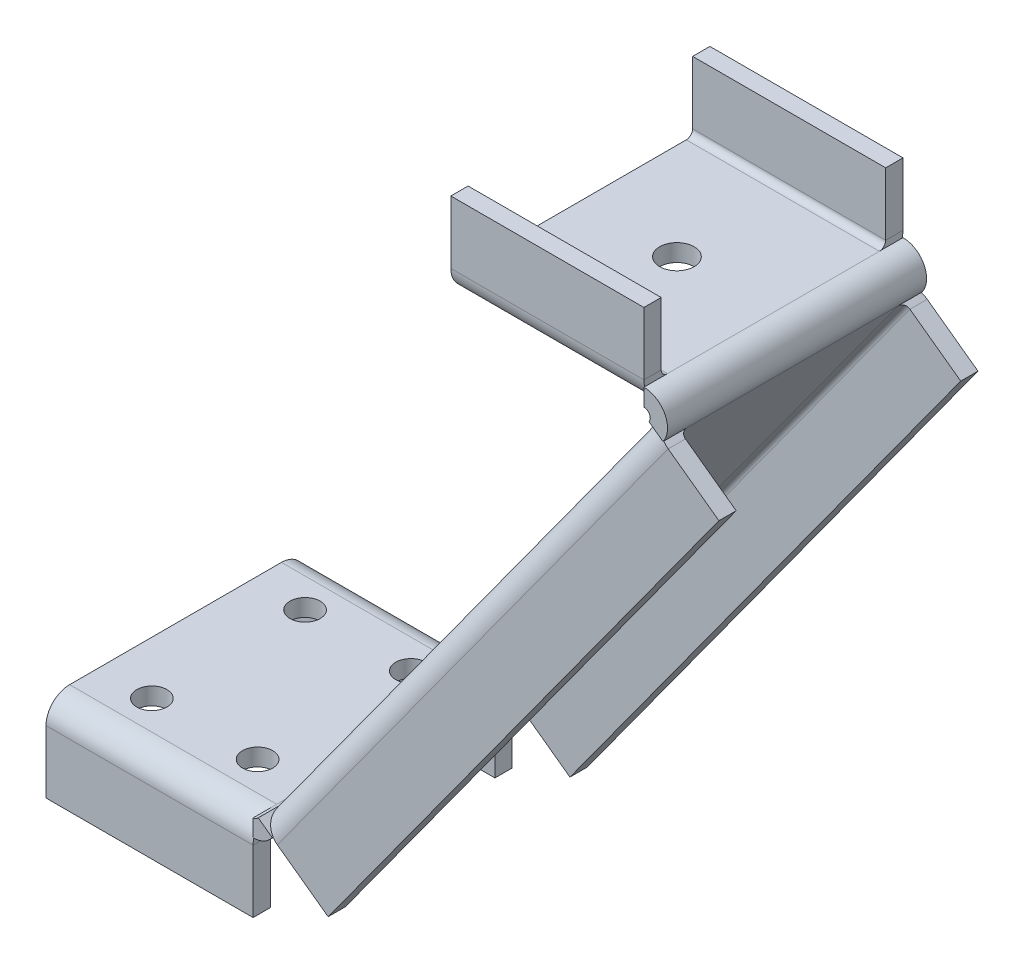
from build123d import *

# Parameters (mm, degrees)
BASE_FLANGE1_DEPTH             = 30
EDGE_FLANGE3_STRIP_W           = 9.4732
EDGE_FLANGE3_STRIP_H           = 2
EDGE_FLANGE3_STRIP_CUT_DEPTH   = 23.982438423
EDGE_FLANGE3_STRIP_2_W         = 9.4732
EDGE_FLANGE3_STRIP_2_H         = 2
EDGE_FLANGE3_STRIP_CUT_2_DEPTH = 23.982438423
EDGE_FLANGE3_STRIP_3_W         = 9.4732
EDGE_FLANGE3_STRIP_3_H         = 2
EDGE_FLANGE3_STRIP_CUT_3_DEPTH = 22.356175112
EDGE_FLANGE3_STRIP_4_W         = 9.4732
EDGE_FLANGE3_STRIP_4_H         = 2
EDGE_FLANGE3_STRIP_CUT_4_DEPTH = 22.356175112
EDGE_FLANGE3_STRIP_5_W         = 9.4732
EDGE_FLANGE3_STRIP_5_H         = 2
EDGE_FLANGE3_STRIP_CUT_5_DEPTH = 77.034991311
EDGE_FLANGE3_STRIP_6_W         = 9.4732
EDGE_FLANGE3_STRIP_6_H         = 2
EDGE_FLANGE3_STRIP_CUT_6_DEPTH = 77.034991311
EDGE_FLANGE3_DEPTH             = 23.982438423
EDGE_FLANGE3_BEND_DEPTH        = 23.982438423
EDGE_FLANGE3_BEND_2_DEPTH      = 22.356175112
EDGE_FLANGE3_BEND_3_DEPTH      = 22.356175112
EDGE_FLANGE3_BEND_4_DEPTH      = 77.034991311
EDGE_FLANGE3_BEND_5_DEPTH      = 77.034991311
CUT_EXTRUDE1_REACH             = 114.784
SKETCH35_R                     = 1.75
SKETCH35_R_2                   = 2


# Sheet-metal steps are written as plain solids
with BuildPart() as part:
    # Sketch1 → Base-Flange1 (new body)
    with BuildSketch(Plane.XY):
        with BuildLine():
            Line((0, 0), (23.982438423, 0))
            ThreePointArc((23.982438423, 0), (24.316990043, 0.080357077), (24.578547934, 0.3038957))
            Line((24.578547934, 0.3038957), (69.831564503, 62.646131606))
            ThreePointArc((69.831564503, 62.646131606), (69.891697915, 63.413387526), (69.235454992, 63.815435906))
            Line((69.235454992, 63.815435906), (46.87927988, 63.815435906))
            Line((46.87927988, 63.815435906), (46.87927988, 65.815435906))
            Line((46.87927988, 65.815435906), (69.235454992, 65.815435906))
            ThreePointArc((69.235454992, 65.815435906), (71.673514159, 64.321754671), (71.450107838, 61.471262477))
            Line((71.450107838, 61.471262477), (26.19709127, -0.870973429))
            ThreePointArc((26.19709127, -0.870973429), (25.225357188, -1.701459167), (23.982438423, -2))
            Line((23.982438423, -2), (0, -2))
            Line((0, -2), (0, 0))
        make_face()
    extrude(amount=BASE_FLANGE1_DEPTH)

    # Edge-Flange3 strip (across the edge) → Edge-Flange3 strip cut (cut)
    with BuildSketch(Plane(origin=(0, -2, 0), x_dir=(0, 0, 1), z_dir=(1, 0, 0))):
        with Locations((-2, -1)):
            Rectangle(EDGE_FLANGE3_STRIP_W, EDGE_FLANGE3_STRIP_H)
    extrude(amount=EDGE_FLANGE3_STRIP_CUT_DEPTH, mode=Mode.SUBTRACT)

    # Edge-Flange3 strip 2 (across the edge) → Edge-Flange3 strip cut 2 (cut)
    with BuildSketch(Plane(origin=(23.982438423, -2, 30), x_dir=(0, 0, -1), z_dir=(-1, 0, 0))):
        with Locations((-2, -1)):
            Rectangle(EDGE_FLANGE3_STRIP_2_W, EDGE_FLANGE3_STRIP_2_H)
    extrude(amount=EDGE_FLANGE3_STRIP_CUT_2_DEPTH, mode=Mode.SUBTRACT)

    # Edge-Flange3 strip 3 (across the edge) → Edge-Flange3 strip cut 3 (cut)
    with BuildSketch(Plane(origin=(46.87927988, 65.815435906, 30), x_dir=(0, 0, -1), z_dir=(1, 0, 0))):
        with Locations((-2, -1)):
            Rectangle(EDGE_FLANGE3_STRIP_3_W, EDGE_FLANGE3_STRIP_3_H)
    extrude(amount=EDGE_FLANGE3_STRIP_CUT_3_DEPTH, mode=Mode.SUBTRACT)

    # Edge-Flange3 strip 4 (across the edge) → Edge-Flange3 strip cut 4 (cut)
    with BuildSketch(Plane(origin=(69.235454992, 65.815435906, 0), x_dir=(0, 0, 1), z_dir=(-1, 0, 0))):
        with Locations((-2, -1)):
            Rectangle(EDGE_FLANGE3_STRIP_4_W, EDGE_FLANGE3_STRIP_4_H)
    extrude(amount=EDGE_FLANGE3_STRIP_CUT_4_DEPTH, mode=Mode.SUBTRACT)

    # Edge-Flange3 strip 5 (across the edge) → Edge-Flange3 strip cut 5 (cut)
    with BuildSketch(Plane(origin=(26.19709127, -0.870973429, 0), x_dir=(0, 0, 1), z_dir=(0.5874345644557342, 0.8092716679105367, 0))):
        with Locations((-2, -1)):
            Rectangle(EDGE_FLANGE3_STRIP_5_W, EDGE_FLANGE3_STRIP_5_H)
    extrude(amount=EDGE_FLANGE3_STRIP_CUT_5_DEPTH, mode=Mode.SUBTRACT)

    # Edge-Flange3 strip 6 (across the edge) → Edge-Flange3 strip cut 6 (cut)
    with BuildSketch(Plane(origin=(71.450107838, 61.471262477, 30), x_dir=(0, 0, -1), z_dir=(-0.5874345644557342, -0.8092716679105367, 0))):
        with Locations((-2, -1)):
            Rectangle(EDGE_FLANGE3_STRIP_6_W, EDGE_FLANGE3_STRIP_6_H)
    extrude(amount=EDGE_FLANGE3_STRIP_CUT_6_DEPTH, mode=Mode.SUBTRACT)

    # Edge-Flange3 section (across the edge) → Edge-Flange3 (add)
    with BuildSketch(Plane(origin=(0, -2, 0), x_dir=(0, 0, 1), z_dir=(1, 0, 0))):
        with BuildLine():
            Line((0, 0.7366), (0, 8))
            Line((0, 8), (2, 8))
            Line((2, 8), (2, 0.7366))
            ThreePointArc((2, 0.7366), (2.215745145, 0.215745145), (2.7366, 0))
            Line((2.7366, 0), (2.7366, -2))
            ThreePointArc((2.7366, -2), (0.801531583, -1.198468417), (0, 0.7366))
        make_face()
    extrude(amount=EDGE_FLANGE3_DEPTH)

    # Edge-Flange3 section 2 (across the edge) → Edge-Flange3 bend (add)
    with BuildSketch(Plane(origin=(23.982438423, -2, 30), x_dir=(0, 0, -1), z_dir=(-1, 0, 0))):
        with BuildLine():
            Line((0, 0.7366), (0, 8))
            Line((0, 8), (2, 8))
            Line((2, 8), (2, 0.7366))
            ThreePointArc((2, 0.7366), (2.215745145, 0.215745145), (2.7366, 0))
            Line((2.7366, 0), (2.7366, -2))
            ThreePointArc((2.7366, -2), (0.801531583, -1.198468417), (0, 0.7366))
        make_face()
    extrude(amount=EDGE_FLANGE3_BEND_DEPTH)

    # Edge-Flange3 section 3 (across the edge) → Edge-Flange3 bend 2 (add)
    with BuildSketch(Plane(origin=(46.87927988, 65.815435906, 30), x_dir=(0, 0, -1), z_dir=(1, 0, 0))):
        with BuildLine():
            Line((0, 0.7366), (0, 8))
            Line((0, 8), (2, 8))
            Line((2, 8), (2, 0.7366))
            ThreePointArc((2, 0.7366), (2.215745145, 0.215745145), (2.7366, 0))
            Line((2.7366, 0), (2.7366, -2))
            ThreePointArc((2.7366, -2), (0.801531583, -1.198468417), (0, 0.7366))
        make_face()
    extrude(amount=EDGE_FLANGE3_BEND_2_DEPTH)

    # Edge-Flange3 section 4 (across the edge) → Edge-Flange3 bend 3 (add)
    with BuildSketch(Plane(origin=(69.235454992, 65.815435906, 0), x_dir=(0, 0, 1), z_dir=(-1, 0, 0))):
        with BuildLine():
            Line((0, 0.7366), (0, 8))
            Line((0, 8), (2, 8))
            Line((2, 8), (2, 0.7366))
            ThreePointArc((2, 0.7366), (2.215745145, 0.215745145), (2.7366, 0))
            Line((2.7366, 0), (2.7366, -2))
            ThreePointArc((2.7366, -2), (0.801531583, -1.198468417), (0, 0.7366))
        make_face()
    extrude(amount=EDGE_FLANGE3_BEND_3_DEPTH)

    # Edge-Flange3 section 5 (across the edge) → Edge-Flange3 bend 4 (add)
    with BuildSketch(Plane(origin=(26.19709127, -0.870973429, 0), x_dir=(0, 0, 1), z_dir=(0.5874345644557342, 0.8092716679105367, 0))):
        with BuildLine():
            Line((0, 0.7366), (0, 8))
            Line((0, 8), (2, 8))
            Line((2, 8), (2, 0.7366))
            ThreePointArc((2, 0.7366), (2.215745145, 0.215745145), (2.7366, 0))
            Line((2.7366, 0), (2.7366, -2))
            ThreePointArc((2.7366, -2), (0.801531583, -1.198468417), (0, 0.7366))
        make_face()
    extrude(amount=EDGE_FLANGE3_BEND_4_DEPTH)

    # Edge-Flange3 section 6 (across the edge) → Edge-Flange3 bend 5 (add)
    with BuildSketch(Plane(origin=(71.450107838, 61.471262477, 30), x_dir=(0, 0, -1), z_dir=(-0.5874345644557342, -0.8092716679105367, 0))):
        with BuildLine():
            Line((0, 0.7366), (0, 8))
            Line((0, 8), (2, 8))
            Line((2, 8), (2, 0.7366))
            ThreePointArc((2, 0.7366), (2.215745145, 0.215745145), (2.7366, 0))
            Line((2.7366, 0), (2.7366, -2))
            ThreePointArc((2.7366, -2), (0.801531583, -1.198468417), (0, 0.7366))
        make_face()
    extrude(amount=EDGE_FLANGE3_BEND_5_DEPTH)

    # Sketch35 → Cut-Extrude1 (cut, up to next)
    with BuildSketch(Plane(origin=(0, 65.815435906, 0), x_dir=(1, 0, 0), z_dir=(0, 1, 0)), mode=Mode.PRIVATE) as cut_extrude1_sk1:
        with Locations(Location((6.128769165, -6.128769165, 0), (0, 0, 270))):
            Circle(SKETCH35_R)
    cut_extrude1_tool1 = extrude(cut_extrude1_sk1.sketch, amount=-CUT_EXTRUDE1_REACH, mode=Mode.PRIVATE) & part.part
    # Sketch35 → Cut-Extrude1 (cut, up to next)
    with BuildSketch(Plane(origin=(0, 65.815435906, 0), x_dir=(1, 0, 0), z_dir=(0, 1, 0)), mode=Mode.PRIVATE) as cut_extrude1_sk2:
        with Locations(Location((18.374243868, -6.128769165, 0), (0, 0, 270))):
            Circle(SKETCH35_R)
    cut_extrude1_tool2 = extrude(cut_extrude1_sk2.sketch, amount=-CUT_EXTRUDE1_REACH, mode=Mode.PRIVATE) & part.part
    # Sketch35 → Cut-Extrude1 (cut, up to next)
    with BuildSketch(Plane(origin=(0, 65.815435906, 0), x_dir=(1, 0, 0), z_dir=(0, 1, 0)), mode=Mode.PRIVATE) as cut_extrude1_sk3:
        with Locations(Location((6.128769165, -23.871230835, 0), (0, 0, 270))):
            Circle(SKETCH35_R)
    cut_extrude1_tool3 = extrude(cut_extrude1_sk3.sketch, amount=-CUT_EXTRUDE1_REACH, mode=Mode.PRIVATE) & part.part
    # Sketch35 → Cut-Extrude1 (cut, up to next)
    with BuildSketch(Plane(origin=(0, 65.815435906, 0), x_dir=(1, 0, 0), z_dir=(0, 1, 0)), mode=Mode.PRIVATE) as cut_extrude1_sk4:
        with Locations(Location((18.374243868, -23.871230835, 0), (0, 0, 270))):
            Circle(SKETCH35_R)
    cut_extrude1_tool4 = extrude(cut_extrude1_sk4.sketch, amount=-CUT_EXTRUDE1_REACH, mode=Mode.PRIVATE) & part.part
    # Sketch35 → Cut-Extrude1 (cut, up to next)
    with BuildSketch(Plane(origin=(0, 65.815435906, 0), x_dir=(1, 0, 0), z_dir=(0, 1, 0)), mode=Mode.PRIVATE) as cut_extrude1_sk5:
        with Locations(Location((58.057367436, -15, 0), (0, 0, 270))):
            Circle(SKETCH35_R_2)
    cut_extrude1_tool5 = extrude(cut_extrude1_sk5.sketch, amount=-CUT_EXTRUDE1_REACH, mode=Mode.PRIVATE) & part.part
    add(cut_extrude1_tool1.solids().sort_by_distance((6.128769, 65.815436, 6.128769))[0], mode=Mode.SUBTRACT)
    add(cut_extrude1_tool2.solids().sort_by_distance((18.374244, 65.815436, 6.128769))[0], mode=Mode.SUBTRACT)
    add(cut_extrude1_tool3.solids().sort_by_distance((6.128769, 65.815436, 23.871231))[0], mode=Mode.SUBTRACT)
    add(cut_extrude1_tool4.solids().sort_by_distance((18.374244, 65.815436, 23.871231))[0], mode=Mode.SUBTRACT)
    add(cut_extrude1_tool5.solids().sort_by_distance((58.057367, 65.815436, 15))[0], mode=Mode.SUBTRACT)


solid = part.part
